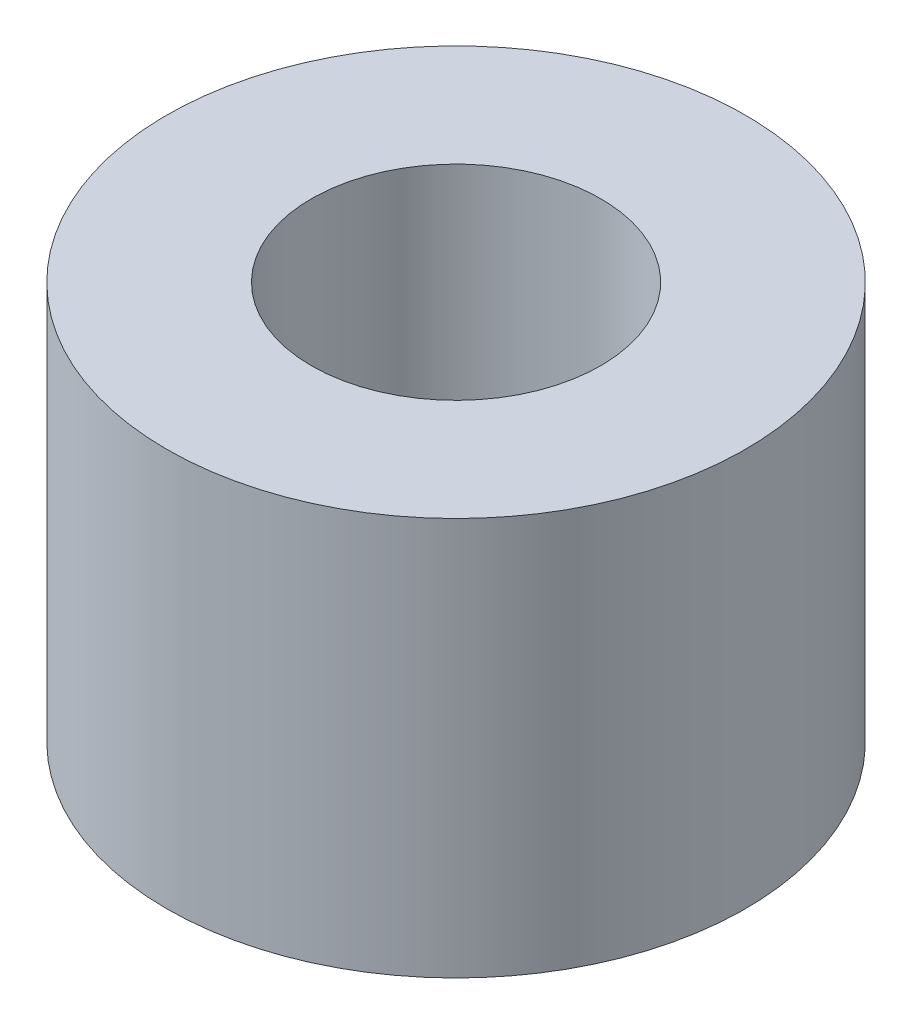
from build123d import *

# Parameters (mm, degrees)
SKETCH1_R           = 4
SKETCH1_R_2         = 2
BOSS_EXTRUDE1_DEPTH = 5.5


with BuildPart() as part:
    # Sketch1 → Boss-Extrude1 (new body)
    with BuildSketch(Plane(origin=(0, 0, 0), x_dir=(1, 0, 0), z_dir=(0, 1, 0))):
        Circle(SKETCH1_R)
        Circle(SKETCH1_R_2, mode=Mode.SUBTRACT)
    extrude(amount=BOSS_EXTRUDE1_DEPTH)


solid = part.part
